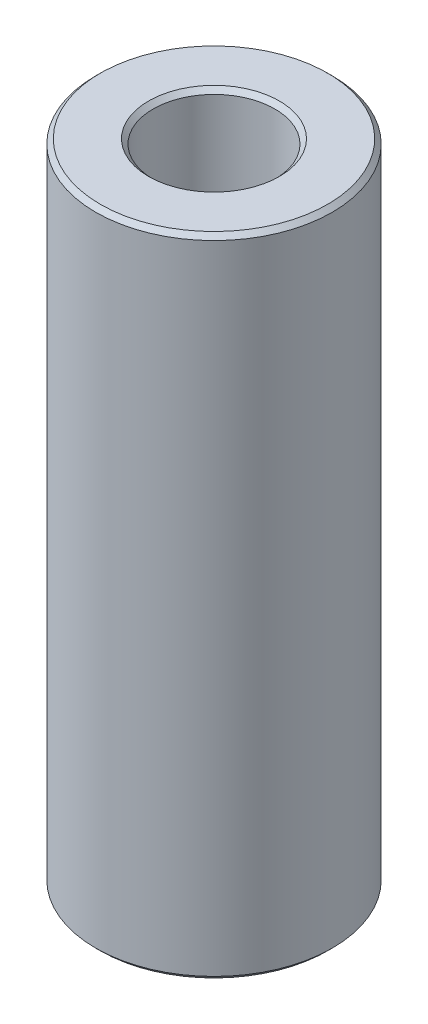
from build123d import *

# Parameters (mm, degrees)
SKETCH1_R           = 25
BOSS_EXTRUDE1_DEPTH = 136.675771932
SKETCH2_R           = 12.860719744
CUT_EXTRUDE1_DEPTH  = 142.174596275
CHAMFER1_SIZE       = 0.972063221


with BuildPart() as part:
    # Sketch1 → Boss-Extrude1 (new body)
    with BuildSketch(Plane(origin=(0, 0, 0), x_dir=(1, 0, 0), z_dir=(0, 1, 0))):
        Circle(SKETCH1_R)
    extrude(amount=BOSS_EXTRUDE1_DEPTH)

    # Sketch2 → Cut-Extrude1 (cut, through all)
    with BuildSketch(Plane(origin=(0, 0, 0), x_dir=(1, 0, 0), z_dir=(0, 1, 0))):
        Circle(SKETCH2_R)
    extrude(amount=CUT_EXTRUDE1_DEPTH, mode=Mode.SUBTRACT)

    # Chamfer1
    chamfer1_edges = [part.edges().sort_by_distance(p)[0] for p in [
        (-12.860719744, 136.675771932, 0),
        (-12.860719744, 0, 0),
        (-25, 0, 0),
        (-25, 136.675771932, 0),
    ]]
    chamfer(chamfer1_edges, length=CHAMFER1_SIZE)


solid = part.part
